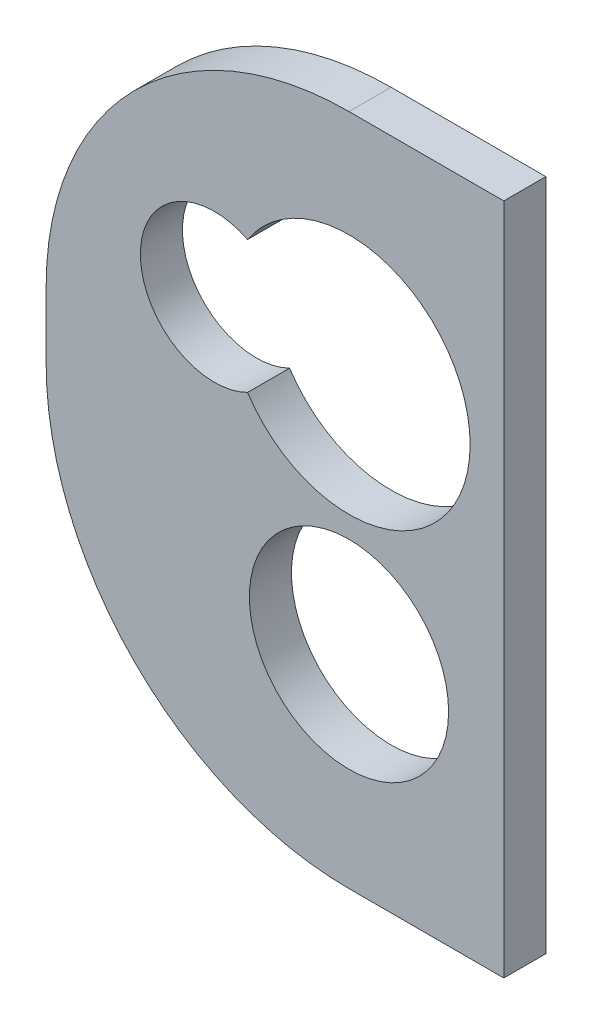
from build123d import *

# Parameters (mm, degrees)
SKETCH1_R           = 3.7592
BOSS_EXTRUDE1_DEPTH = 1.5875


with BuildPart() as part:
    # Sketch1 → Boss-Extrude1 (new body)
    with BuildSketch(Plane.XY):
        with BuildLine():
            Line((5.842, 17.741270299), (0, 17.741270299))
            ThreePointArc((0, 17.741270299), (-8.082230509, 14.393500808), (-11.43, 6.311270299))
            Line((-11.43, 6.311270299), (-11.43, 3.771270299))
            ThreePointArc((-11.43, 3.771270299), (-8.082230509, -4.31096021), (0, -7.658729701))
            Line((0, -7.658729701), (5.842, -7.658729701))
            Line((5.842, -7.658729701), (5.842, 17.741270299))
        make_face()
        Circle(SKETCH1_R, mode=Mode.SUBTRACT)
        with BuildLine():
            ThreePointArc((-3.82905, 6.645688551), (4.572, 9.144), (-3.82905, 11.642311449))
            ThreePointArc((-3.82905, 11.642311449), (-7.874, 9.144), (-3.82905, 6.645688551))
        make_face(mode=Mode.SUBTRACT)
    extrude(amount=BOSS_EXTRUDE1_DEPTH)


solid = part.part
